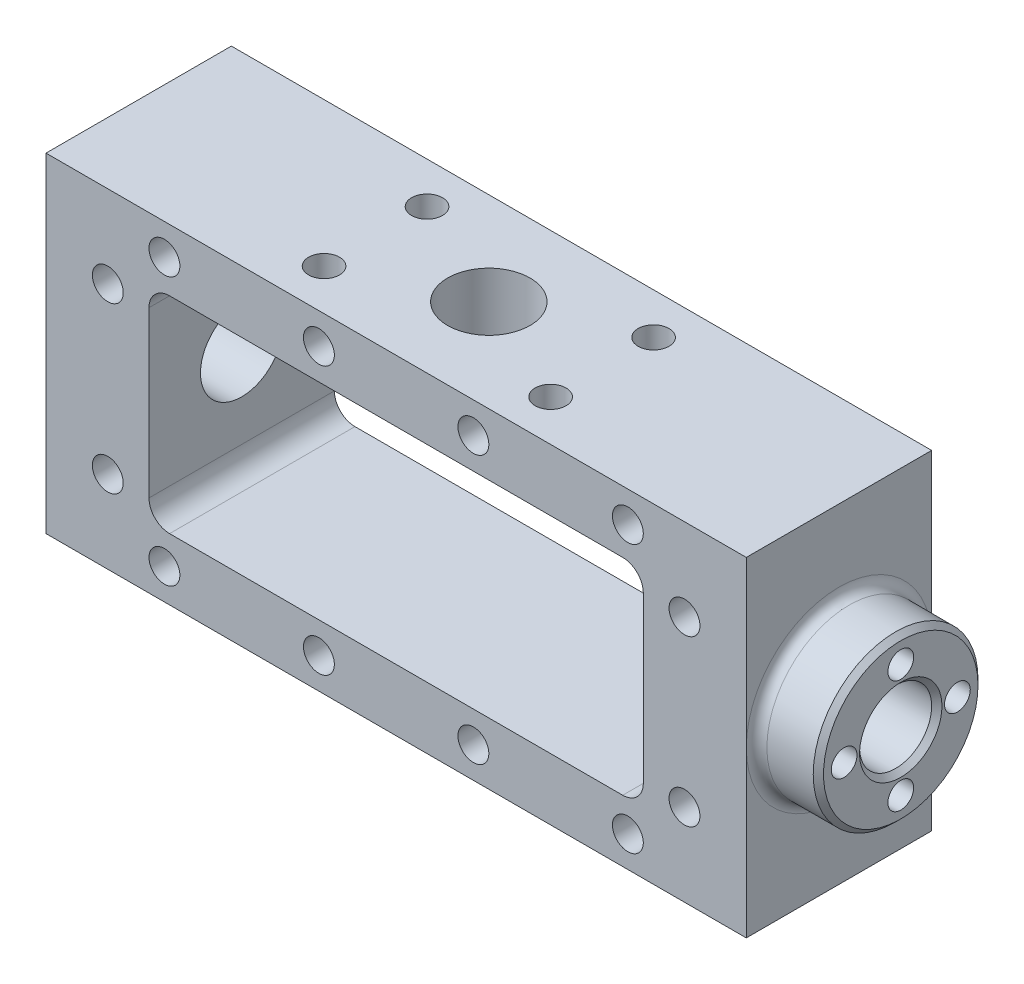
from build123d import *

# Parameters (mm, degrees)
SKETCH2_W           = 68
SKETCH2_H           = 32
BOSS_EXTRUDE1_DEPTH = 18
SKETCH3_R           = 8
BOSS_EXTRUDE2_DEPTH = 6
FILLET1_R           = 1
SKETCH4_R           = 4
CUT_EXTRUDE1_DEPTH  = 10
CUT_EXTRUDE2_DEPTH  = 47.69047012
SKETCH6_R           = 1.5
CUT_EXTRUDE3_DEPTH  = 47.69047012
SKETCH7_R           = 3.5
CUT_EXTRUDE4_DEPTH  = 12
SKETCH8_R           = 3
CUT_EXTRUDE5_DEPTH  = 67.513156593
SKETCH9_R           = 1.25
CUT_EXTRUDE6_DEPTH  = 5
SKETCH10_R          = 4
SKETCH10_R_2        = 1.5
CUT_EXTRUDE9_DEPTH  = 47.69047012
CHAMFER1_SIZE       = 0.5
CHAMFER2_SIZE       = 0.5


with BuildPart() as part:
    # Sketch2 → Boss-Extrude1 (new body)
    with BuildSketch(Plane.XY):
        Rectangle(SKETCH2_W, SKETCH2_H)
    extrude(amount=BOSS_EXTRUDE1_DEPTH)

    # Sketch3 → Boss-Extrude2 (add)
    with BuildSketch(Plane(origin=(34, 0, 0), x_dir=(0, 0, -1), z_dir=(1, 0, 0))):
        with Locations((-9, 0)):
            Circle(SKETCH3_R)
    extrude(amount=BOSS_EXTRUDE2_DEPTH)

    # Fillet1
    fillet1_edges = [part.edges().sort_by_distance(p)[0] for p in [
        (34, 0, 17),
    ]]
    fillet(fillet1_edges, radius=FILLET1_R - 0.0001)  # a hair under: the kernel refuses the full size

    # Sketch4 → Cut-Extrude1 (cut)
    with BuildSketch(Plane.ZY.offset(34)):
        with Locations((9, 0)):
            Circle(SKETCH4_R)
    extrude(amount=-CUT_EXTRUDE1_DEPTH, mode=Mode.SUBTRACT)

    # Sketch5 → Cut-Extrude2 (cut, through all)
    with BuildSketch(Plane.XY.offset(18)):
        with BuildLine():
            Line((22, -10), (-22, -10))
            ThreePointArc((-22, -10), (-23.414213562, -9.414213562), (-24, -8))
            Line((-24, -8), (-24, 8))
            ThreePointArc((-24, 8), (-23.414213562, 9.414213562), (-22, 10))
            Line((-22, 10), (22, 10))
            ThreePointArc((22, 10), (23.414213562, 9.414213562), (24, 8))
            Line((24, 8), (24, -8))
            ThreePointArc((24, -8), (23.414213562, -9.414213562), (22, -10))
        make_face()
    extrude(amount=-CUT_EXTRUDE2_DEPTH, mode=Mode.SUBTRACT)

    # Sketch6 → Cut-Extrude3 (cut, through all)
    with BuildSketch(Plane.XY.offset(18)):
        with Locations((-22.5, 13)):
            Circle(SKETCH6_R)
        with Locations((-7.5, 13)):
            Circle(SKETCH6_R)
        with Locations((7.5, 13)):
            Circle(SKETCH6_R)
        with Locations((22.5, 13)):
            Circle(SKETCH6_R)
        with Locations(Location((22.5, -13, 0), (0, 0, 180))):
            Circle(SKETCH6_R)
        with Locations(Location((7.5, -13, 0), (0, 0, 180))):
            Circle(SKETCH6_R)
        with Locations(Location((-7.5, -13, 0), (0, 0, 180))):
            Circle(SKETCH6_R)
        with Locations(Location((-22.5, -13, 0), (0, 0, 180))):
            Circle(SKETCH6_R)
        with Locations((28, -8)):
            Circle(SKETCH6_R)
        with Locations(Location((28, 8, 0), (0, 0, 180))):
            Circle(SKETCH6_R)
        with Locations((-28, 8)):
            Circle(SKETCH6_R)
        with Locations(Location((-28, -8, 0), (0, 0, 180))):
            Circle(SKETCH6_R)
    extrude(amount=-CUT_EXTRUDE3_DEPTH, mode=Mode.SUBTRACT)

    # Sketch7 → Cut-Extrude4 (cut)
    with BuildSketch(Plane(origin=(40, 0, 0), x_dir=(0, 0, -1), z_dir=(1, 0, 0))):
        with Locations((-9, 0)):
            Circle(SKETCH7_R)
    extrude(amount=-CUT_EXTRUDE4_DEPTH, mode=Mode.SUBTRACT)

    # Sketch8 → Cut-Extrude5 (cut, through all)
    with BuildSketch(Plane(origin=(28, 0, 0), x_dir=(0, 0, -1), z_dir=(1, 0, 0))):
        with Locations((-9, 0)):
            Circle(SKETCH8_R)
    extrude(amount=-CUT_EXTRUDE5_DEPTH, mode=Mode.SUBTRACT)

    # Sketch9 → Cut-Extrude6 (cut)
    with BuildSketch(Plane(origin=(40, 0, 0), x_dir=(0, 0, -1), z_dir=(1, 0, 0))):
        with Locations((-9, 5.5)):
            Circle(SKETCH9_R)
        with Locations((-9, -5.5)):
            Circle(SKETCH9_R)
        with Locations((-3.5, 0)):
            Circle(SKETCH9_R)
        with Locations((-14.5, 0)):
            Circle(SKETCH9_R)
    extrude(amount=-CUT_EXTRUDE6_DEPTH, mode=Mode.SUBTRACT)

    # Sketch10 → Cut-Extrude9 (cut, through all)
    with BuildSketch(Plane(origin=(0, 0, 0), x_dir=(1, 0, 0), z_dir=(0, 1, 0))):
        with Locations(Location((0, -9, 0), (0, 0, 180))):
            Circle(SKETCH10_R)
        with Locations(Location((-11, -4, 0), (0, 0, 180))):
            Circle(SKETCH10_R_2)
        with Locations(Location((11, -4, 0), (0, 0, 90))):
            Circle(SKETCH10_R_2)
        with Locations(Location((11, -14, 0), (0, 0, 180))):
            Circle(SKETCH10_R_2)
        with Locations(Location((-11, -14, 0), (0, 0, 90))):
            Circle(SKETCH10_R_2)
    extrude(amount=CUT_EXTRUDE9_DEPTH, mode=Mode.SUBTRACT)

    # Chamfer1
    chamfer1_edges = [part.edges().sort_by_distance(p)[0] for p in [
        (-34, 0, 5),
    ]]
    chamfer(chamfer1_edges, length=CHAMFER1_SIZE)

    # Chamfer2
    chamfer2_edges = [part.edges().sort_by_distance(p)[0] for p in [
        (40, 0, 12.5),
        (40, 0, 17),
    ]]
    chamfer(chamfer2_edges, length=CHAMFER2_SIZE)


solid = part.part
